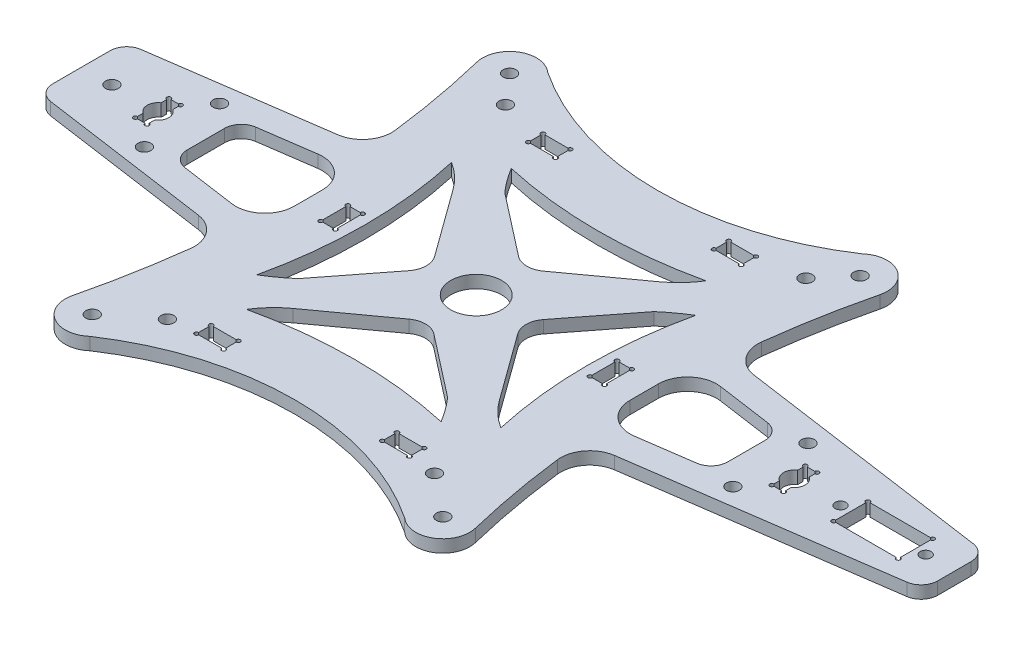
from build123d import *

# Parameters (mm, degrees)
SKETCH_1_R             = 1.55
SKETCH_1_R_2           = 1.3
SKETCH_1_W             = 6.5
SKETCH_1_H             = 3.5
SKETCH_1_W_2           = 3.5
SKETCH_1_H_2           = 6.5
SKETCH_1_W_3           = 15.5
SKETCH_1_H_3           = 8.2
EXTRUDE_1_DEPTH        = 3
FILLET_1_R             = 4
FILLET_2_R             = 7
SKETCH_2_R             = 0.5
CUT_EXTRUDE_4998_DEPTH = 128.780965393
SKETCH_3_R             = 6.1
CUT_EXTRUDE_2_DEPTH    = 128.780965393
FILLET_3_R             = 5


with BuildPart() as part:
    # 草图1 → 凸台-拉伸1 (new body)
    with BuildSketch(Plane(origin=(0, 0, 0), x_dir=(1, 0, 0), z_dir=(0, 1, 0))):
        with BuildLine():
            Line((114.591143215, 7.468307572), (114.591143215, -7.468307572))
            Line((114.591143215, -7.468307572), (43.193640968, -17.646273029))
            ThreePointArc((43.193640968, -17.646273029), (45.143245402, -33.15226541), (48.27557779, -48.463217404))
            ThreePointArc((48.27557779, -48.463217404), (45.335063646, -55.533708325), (37.709796983, -54.831018053))
            ThreePointArc((37.709796983, -54.831018053), (0, -43.436211003), (-37.709796983, -54.831018053))
            ThreePointArc((-37.709796983, -54.831018053), (-45.335063646, -55.533708325), (-48.27557779, -48.463217404))
            ThreePointArc((-48.27557779, -48.463217404), (-45.143245402, -33.15226541), (-43.193640968, -17.646273029))
            Line((-43.193640968, -17.646273029), (-94.579518436, -10.321035179))
            Line((-94.579518436, -10.321035179), (-94.579518436, 10.321035179))
            Line((-94.579518436, 10.321035179), (-43.193640968, 17.646273029))
            ThreePointArc((-43.193640968, 17.646273029), (-45.143245402, 33.15226541), (-48.27557779, 48.463217404))
            ThreePointArc((-48.27557779, 48.463217404), (-45.335063646, 55.533708325), (-37.709796983, 54.831018053))
            ThreePointArc((-37.709796983, 54.831018053), (0, 43.436211003), (37.709796983, 54.831018053))
            ThreePointArc((37.709796983, 54.831018053), (45.335063646, 55.533708325), (48.27557779, 48.463217404))
            ThreePointArc((48.27557779, 48.463217404), (45.143245402, 33.15226541), (43.193640968, 17.646273029))
            Line((43.193640968, 17.646273029), (114.591143215, 7.468307572))
        make_face()
        with Locations((-36, 43)):
            Circle(SKETCH_1_R, mode=Mode.SUBTRACT)
        with Locations((-32, -42)):
            Circle(SKETCH_1_R, mode=Mode.SUBTRACT)
        with Locations((32, -42)):
            Circle(SKETCH_1_R, mode=Mode.SUBTRACT)
        with Locations((36, 43)):
            Circle(SKETCH_1_R, mode=Mode.SUBTRACT)
        with Locations((42, 50)):
            Circle(SKETCH_1_R, mode=Mode.SUBTRACT)
        with Locations((42, -50)):
            Circle(SKETCH_1_R, mode=Mode.SUBTRACT)
        with Locations((-42, -50)):
            Circle(SKETCH_1_R, mode=Mode.SUBTRACT)
        with Locations((-42, 50)):
            Circle(SKETCH_1_R, mode=Mode.SUBTRACT)
        with Locations((107.7, 0)):
            Circle(SKETCH_1_R_2, mode=Mode.SUBTRACT)
        with Locations((87.3, 0)):
            Circle(SKETCH_1_R_2, mode=Mode.SUBTRACT)
        with Locations((70.5, 9)):
            Circle(SKETCH_1_R, mode=Mode.SUBTRACT)
        with Locations((70.5, -9)):
            Circle(SKETCH_1_R, mode=Mode.SUBTRACT)
        with Locations((-70.5, -9)):
            Circle(SKETCH_1_R, mode=Mode.SUBTRACT)
        with Locations((-70.5, 9)):
            Circle(SKETCH_1_R, mode=Mode.SUBTRACT)
        with Locations((-87.3, 0)):
            Circle(SKETCH_1_R, mode=Mode.SUBTRACT)
        with Locations((-22.25, 39.75)):
            Rectangle(SKETCH_1_W, SKETCH_1_H, mode=Mode.SUBTRACT)
        with Locations((-32.25, 0)):
            Rectangle(SKETCH_1_W_2, SKETCH_1_H_2, mode=Mode.SUBTRACT)
        with Locations((-22.25, -39.75)):
            Rectangle(SKETCH_1_W, SKETCH_1_H, mode=Mode.SUBTRACT)
        with Locations((22.25, 39.75)):
            Rectangle(SKETCH_1_W, SKETCH_1_H, mode=Mode.SUBTRACT)
        with Locations((22.25, -39.75)):
            Rectangle(SKETCH_1_W, SKETCH_1_H, mode=Mode.SUBTRACT)
        with Locations((32.25, 0)):
            Rectangle(SKETCH_1_W_2, SKETCH_1_H_2, mode=Mode.SUBTRACT)
        with BuildLine():
            Line((77.65, -2.151778405), (77.65, -4))
            Line((77.65, -4), (74.85, -4))
            Line((74.85, -4), (74.85, -2.176778405))
            ThreePointArc((74.85, -2.176778405), (73.652957971, 0), (74.85, 2.176778405))
            Line((74.85, 2.176778405), (74.85, 4))
            Line((74.85, 4), (77.65, 4))
            Line((77.65, 4), (77.65, 2.151778405))
            ThreePointArc((77.65, 2.151778405), (78.8083942, 0), (77.65, -2.151778405))
        make_face(mode=Mode.SUBTRACT)
        with Locations((97.5, 0)):
            Rectangle(SKETCH_1_W_3, SKETCH_1_H_3, mode=Mode.SUBTRACT)
        with BuildLine():
            Line((-74.85, -2.176778405), (-74.85, -4))
            Line((-74.85, -4), (-77.65, -4))
            Line((-77.65, -4), (-77.65, -2.151778405))
            ThreePointArc((-77.65, -2.151778405), (-78.8083942, 0), (-77.65, 2.151778405))
            Line((-77.65, 2.151778405), (-77.65, 4))
            Line((-77.65, 4), (-74.85, 4))
            Line((-74.85, 4), (-74.85, 2.176778405))
            ThreePointArc((-74.85, 2.176778405), (-73.652957971, 0), (-74.85, -2.176778405))
        make_face(mode=Mode.SUBTRACT)
        with BuildLine():
            Line((-24.712844908, 19.183966516), (-10.803008194, 0))
            Line((-10.803008194, 0), (-24.712844908, -17.876467816))
            ThreePointArc((-24.712844908, -17.876467816), (-27.509480803, -20.102319762), (-30.485660459, -22.081699431))
            ThreePointArc((-30.485660459, -22.081699431), (-27.899245538, 1.245393512), (-30.485660459, 24.572486455))
            ThreePointArc((-30.485660459, 24.572486455), (-27.339184273, 22.156842317), (-24.712844908, 19.183966516))
        make_face(mode=Mode.SUBTRACT)
        with BuildLine():
            Line((19.183966516, 24.712844908), (0, 10.803008194))
            Line((0, 10.803008194), (-17.876467816, 24.712844908))
            ThreePointArc((-17.876467816, 24.712844908), (-20.102319762, 27.509480803), (-22.081699431, 30.485660459))
            ThreePointArc((-22.081699431, 30.485660459), (1.245393512, 27.899245538), (24.572486455, 30.485660459))
            ThreePointArc((24.572486455, 30.485660459), (22.156842317, 27.339184273), (19.183966516, 24.712844908))
        make_face(mode=Mode.SUBTRACT)
        with BuildLine():
            Line((24.712844908, -19.183966516), (10.803008194, 0))
            Line((10.803008194, 0), (24.712844908, 17.876467816))
            ThreePointArc((24.712844908, 17.876467816), (27.509480803, 20.102319762), (30.485660459, 22.081699431))
            ThreePointArc((30.485660459, 22.081699431), (27.899245538, -1.245393512), (30.485660459, -24.572486455))
            ThreePointArc((30.485660459, -24.572486455), (27.339184273, -22.156842317), (24.712844908, -19.183966516))
        make_face(mode=Mode.SUBTRACT)
        with BuildLine():
            Line((-19.183966516, -24.712844908), (0, -10.803008194))
            Line((0, -10.803008194), (17.876467816, -24.712844908))
            ThreePointArc((17.876467816, -24.712844908), (20.102319762, -27.509480803), (22.081699431, -30.485660459))
            ThreePointArc((22.081699431, -30.485660459), (-1.245393512, -27.899245538), (-24.572486455, -30.485660459))
            ThreePointArc((-24.572486455, -30.485660459), (-22.156842317, -27.339184273), (-19.183966516, -24.712844908))
        make_face(mode=Mode.SUBTRACT)
        Polygon((-64.75, -7.957119899), (-64.75, 7.957119899), (-40.25, 11.449681205), (-40.25, -11.449681205), align=None, mode=Mode.SUBTRACT)
        Polygon((64.75, 7.957119899), (40.25, 11.449681205), (40.25, -11.449681205), (64.75, -7.957119899), align=None, mode=Mode.SUBTRACT)
    extrude(amount=EXTRUDE_1_DEPTH)

    # 圆角1
    fillet_1_edges = [part.edges().sort_by_distance(p)[0] for p in [
        (114.591143215, 1.5, -7.468307572),
        (114.591143215, 1.5, 7.468307572),
        (-94.579518436, 1.5, 10.321035179),
        (-94.579518436, 1.5, -10.321035179),
        (-64.75, 1.5, 7.957119899),
        (-64.75, 1.5, -7.957119899),
        (64.75, 1.5, 7.957119899),
        (64.75, 1.5, -7.957119899),
    ]]
    fillet(fillet_1_edges, radius=FILLET_1_R)

    # 圆角2
    fillet_2_edges = [part.edges().sort_by_distance(p)[0] for p in [
        (43.193640968, 1.5, -17.646273029),
        (43.193640968, 1.5, 17.646273029),
        (-43.193640968, 1.5, 17.646273029),
        (-43.193640968, 1.5, -17.646273029),
        (40.25, 1.5, 11.449681205),
        (40.25, 1.5, -11.449681205),
        (-40.25, 1.5, 11.449681205),
        (-40.25, 1.5, -11.449681205),
    ]]
    fillet(fillet_2_edges, radius=FILLET_2_R)

    # 草图2 → Cut-Extrude 4998 (cut, through all)
    with BuildSketch(Plane(origin=(0, 3, 0), x_dir=(1, 0, 0), z_dir=(0, 1, 0))):
        with Locations((-77.65, 4)):
            Circle(SKETCH_2_R)
        with Locations((-74.85, 4)):
            Circle(SKETCH_2_R)
        with Locations((-77.65, -4)):
            Circle(SKETCH_2_R)
        with Locations((-74.85, -4)):
            Circle(SKETCH_2_R)
        with Locations((-25.5, 41.5)):
            Circle(SKETCH_2_R)
        with Locations((-19, 41.5)):
            Circle(SKETCH_2_R)
        with Locations((-25.5, 38)):
            Circle(SKETCH_2_R)
        with Locations((-19, 38)):
            Circle(SKETCH_2_R)
        with Locations((-34, 3.25)):
            Circle(SKETCH_2_R)
        with Locations((-30.5, 3.25)):
            Circle(SKETCH_2_R)
        with Locations((-34, -3.25)):
            Circle(SKETCH_2_R)
        with Locations((-30.5, -3.25)):
            Circle(SKETCH_2_R)
        with Locations((-25.5, -38)):
            Circle(SKETCH_2_R)
        with Locations((-19, -38)):
            Circle(SKETCH_2_R)
        with Locations((-25.5, -41.5)):
            Circle(SKETCH_2_R)
        with Locations((-19, -41.5)):
            Circle(SKETCH_2_R)
        with Locations((19, -41.5)):
            Circle(SKETCH_2_R)
        with Locations((25.5, -41.5)):
            Circle(SKETCH_2_R)
        with Locations((19, -38)):
            Circle(SKETCH_2_R)
        with Locations((25.5, -38)):
            Circle(SKETCH_2_R)
        with Locations((30.5, -3.25)):
            Circle(SKETCH_2_R)
        with Locations((34, -3.25)):
            Circle(SKETCH_2_R)
        with Locations((30.5, 3.25)):
            Circle(SKETCH_2_R)
        with Locations((34, 3.25)):
            Circle(SKETCH_2_R)
        with Locations((19, 38)):
            Circle(SKETCH_2_R)
        with Locations((25.5, 38)):
            Circle(SKETCH_2_R)
        with Locations((19, 41.5)):
            Circle(SKETCH_2_R)
        with Locations((25.5, 41.5)):
            Circle(SKETCH_2_R)
        with Locations((74.85, -4)):
            Circle(SKETCH_2_R)
        with Locations((77.65, -4)):
            Circle(SKETCH_2_R)
        with Locations((74.85, 4)):
            Circle(SKETCH_2_R)
        with Locations((77.65, 4)):
            Circle(SKETCH_2_R)
        with Locations((89.75, 4.1)):
            Circle(SKETCH_2_R)
        with Locations((105.25, 4.1)):
            Circle(SKETCH_2_R)
        with Locations((89.75, -4.1)):
            Circle(SKETCH_2_R)
        with Locations((105.25, -4.1)):
            Circle(SKETCH_2_R)
    extrude(amount=-CUT_EXTRUDE_4998_DEPTH, mode=Mode.SUBTRACT)

    # 草图3 → 切除-拉伸2 (cut, through all)
    with BuildSketch(Plane(origin=(0, 0, 0), x_dir=(1, 0, 0), z_dir=(0, 1, 0))):
        Circle(SKETCH_3_R)
    extrude(amount=CUT_EXTRUDE_2_DEPTH, mode=Mode.SUBTRACT)

    # 圆角3
    fillet_3_edges = [part.edges().sort_by_distance(p)[0] for p in [
        (0, 1.5, 10.803008194),
        (10.803008194, 1.5, 0),
        (0, 1.5, -10.803008194),
        (-10.803008194, 1.5, 0),
    ]]
    fillet(fillet_3_edges, radius=FILLET_3_R)


solid = part.part
